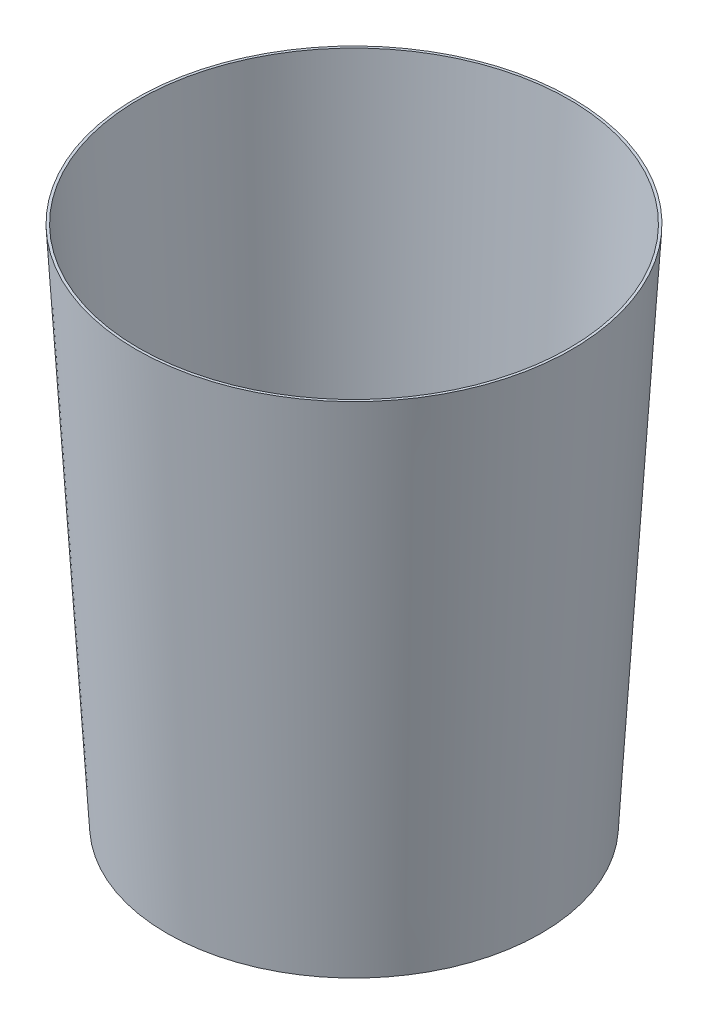
from build123d import *

# Parameters (mm, degrees)
SHELL1_T = 1.778


# Read off the part's stored shape, not the designer's step: Extrude-Thin1
with BuildPart() as part:
    # Extrude-Thin1 outline → Extrude-Thin1 (revolve)
    with BuildSketch(Plane.XY):
        Polygon((0, 368.3), (0, 0), (131.1275, 0), (152.908, 368.3), align=None)
    revolve(axis=Axis((0, 0, 0), (0, 1, 0)))

    # Shell1
    shell1_openings = [part.faces().sort_by_distance(p)[0] for p in [
        (0, 368.3, 0),
    ]]
    offset(amount=SHELL1_T, openings=shell1_openings, kind=Kind.INTERSECTION)


solid = part.part
